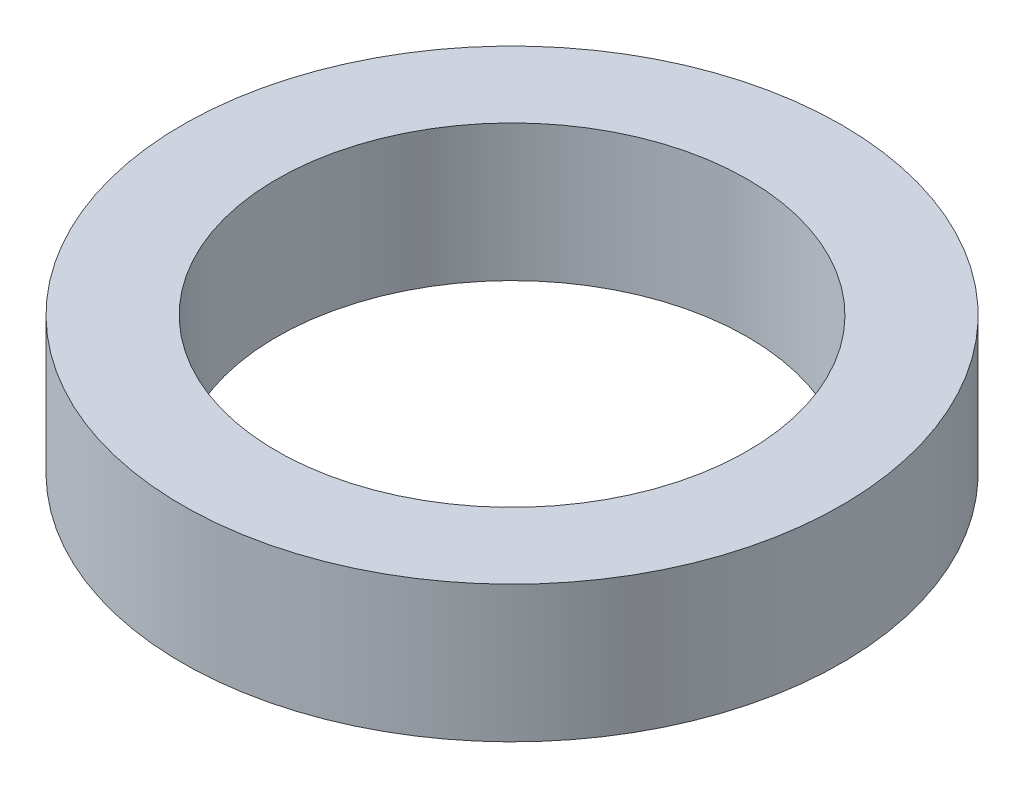
from build123d import *

# Parameters (mm, degrees)
SKETCH1_R           = 70
BOSS_EXTRUDE1_DEPTH = 29
SKETCH2_R           = 50
CUT_EXTRUDE1_DEPTH  = 104.155222844


with BuildPart() as part:
    # Sketch1 → Boss-Extrude1 (new body)
    with BuildSketch(Plane(origin=(0, 0, 0), x_dir=(1, 0, 0), z_dir=(0, 1, 0))):
        Circle(SKETCH1_R)
    extrude(amount=BOSS_EXTRUDE1_DEPTH)

    # Sketch2 → Cut-Extrude1 (cut, through all)
    with BuildSketch(Plane(origin=(0, 0, 0), x_dir=(1, 0, 0), z_dir=(0, 1, 0))):
        Circle(SKETCH2_R)
    extrude(amount=CUT_EXTRUDE1_DEPTH, mode=Mode.SUBTRACT)


solid = part.part
